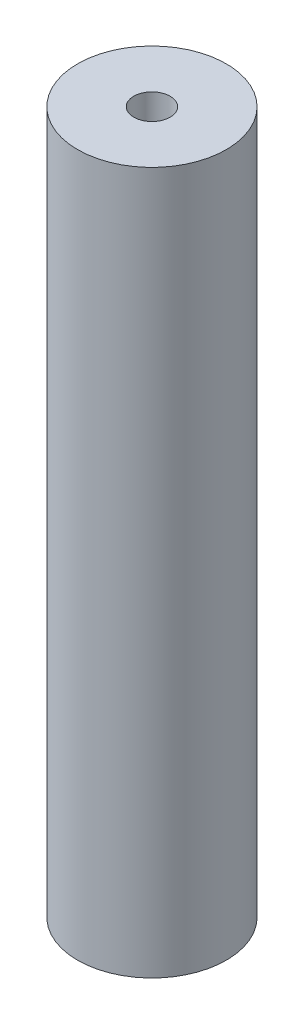
from build123d import *

# Parameters (mm, degrees)
SKETCH1_R           = 11.65
BOSS_EXTRUDE1_DEPTH = 110
SKETCH2_R           = 2.85
CUT_EXTRUDE1_DEPTH  = 110


with BuildPart() as part:
    # Sketch1 → Boss-Extrude1 (new body)
    with BuildSketch(Plane(origin=(0, 0, 0), x_dir=(1, 0, 0), z_dir=(0, 1, 0))):
        Circle(SKETCH1_R)
    extrude(amount=BOSS_EXTRUDE1_DEPTH)

    # Sketch2 → Cut-Extrude1 (cut)
    with BuildSketch(Plane(origin=(0, 110, 0), x_dir=(1, 0, 0), z_dir=(0, 1, 0))):
        Circle(SKETCH2_R)
    extrude(amount=-CUT_EXTRUDE1_DEPTH, mode=Mode.SUBTRACT)


solid = part.part
